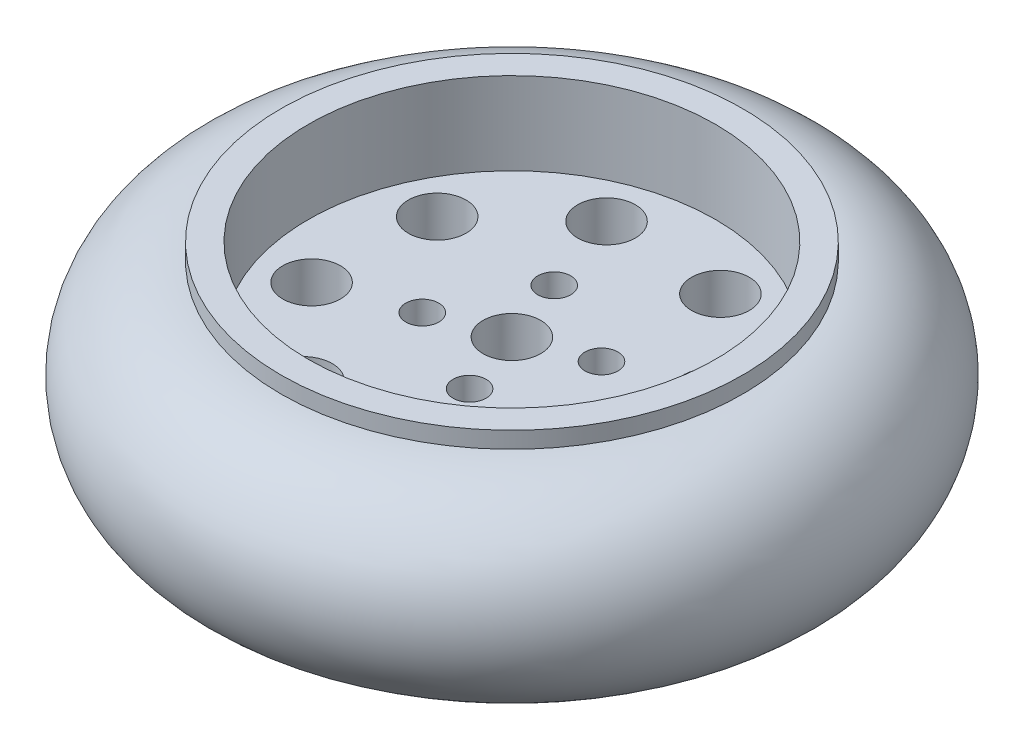
from build123d import *

# Parameters (mm, degrees)
ESQUISSE1_R             = 40
BOSS_EXTRU_1_DEPTH      = 24
CONG_2_R                = 12
ESQUISSE2_R             = 28
ENL_V_MAT_EXTRU_1_DEPTH = 8
ENL_V_START             = -8
ESQUISSE3_R             = 28
ENL_V_MAT_EXTRU_2_DEPTH = 8
ESQUISSE4_R             = 3.5
ESQUISSE4_R_2           = 2
ENL_V_MAT_EXTRU_3_DEPTH = 59.787753895
BOSS_EXTRU_2_START      = 10
ESQUISSE5_R             = 28
ESQUISSE5_R_2           = 24.698706658
BOSS_EXTRU_2_DEPTH      = 10


with BuildPart() as part:
    # Esquisse1 → Boss.-Extru.1 (new body)
    with BuildSketch(Plane(origin=(0, 0, 0), x_dir=(1, 0, 0), z_dir=(0, 1, 0))):
        with Locations(Location((0, 0, 0), (0, 0, 270))):
            Circle(ESQUISSE1_R)
    extrude(amount=BOSS_EXTRU_1_DEPTH)

    # Congé2
    cong_2_edges = [part.edges().sort_by_distance(p)[0] for p in [
        (0, 0, -40),
        (0, 24, -40),
    ]]
    fillet(cong_2_edges, radius=CONG_2_R - 0.0001)  # a hair under: the kernel refuses the full size

    # Esquisse2 → Enlèv. mat.-Extru.1 (cut)
    with BuildSketch(Plane(origin=(0, 24, 0), x_dir=(1, 0, 0), z_dir=(0, 1, 0))):
        with Locations(Location((0, 0, 0), (0, 0, 270))):
            Circle(ESQUISSE2_R)
    extrude(amount=-ENL_V_MAT_EXTRU_1_DEPTH, mode=Mode.SUBTRACT)

    # Esquisse3 → Enlèv. mat.-Extru.2 (cut)
    with BuildSketch(Plane.XZ.offset(ENL_V_START)):
        with Locations(Location((0, 0, 0), (0, 0, 90))):
            Circle(ESQUISSE3_R)
    extrude(amount=ENL_V_MAT_EXTRU_2_DEPTH, mode=Mode.SUBTRACT)

    # Esquisse4 → Enlèv. mat.-Extru.3 (cut, through all)
    with BuildSketch(Plane(origin=(0, 16, 0), x_dir=(1, 0, 0), z_dir=(0, 1, 0))):
        with Locations(Location((0, 0, 0), (0, 0, 270))):
            Circle(ESQUISSE4_R)
        with Locations(Location((-2.866979911, 8.001901411, 0), (0, 0, 270))):
            Circle(ESQUISSE4_R_2)
        with Locations(Location((8.001901411, 2.866979911, 0), (0, 0, 270))):
            Circle(ESQUISSE4_R_2)
        with Locations(Location((2.866979911, -8.001901411, 0), (0, 0, 270))):
            Circle(ESQUISSE4_R_2)
        with Locations(Location((-8.001901411, -2.866979911, 0), (0, 0, 270))):
            Circle(ESQUISSE4_R_2)
        with Locations(Location((-6.408543331, 17.886603154, 0), (0, 0, 270))):
            Circle(ESQUISSE4_R)
        with Locations(Location((8.116213936, 17.179262829, 0), (0, 0, 270))):
            Circle(ESQUISSE4_R)
        with Locations(Location((17.886603154, 6.408543331, 0), (0, 0, 270))):
            Circle(ESQUISSE4_R)
        with Locations(Location((17.179262829, -8.116213936, 0), (0, 0, 270))):
            Circle(ESQUISSE4_R)
        with Locations(Location((6.408543331, -17.886603154, 0), (0, 0, 270))):
            Circle(ESQUISSE4_R)
        with Locations(Location((-8.116213936, -17.179262829, 0), (0, 0, 270))):
            Circle(ESQUISSE4_R)
        with Locations(Location((-17.886603154, -6.408543331, 0), (0, 0, 270))):
            Circle(ESQUISSE4_R)
        with Locations(Location((-17.179262829, 8.116213936, 0), (0, 0, 270))):
            Circle(ESQUISSE4_R)
    extrude(amount=-ENL_V_MAT_EXTRU_3_DEPTH, mode=Mode.SUBTRACT)

    # Esquisse5 → Boss.-Extru.2 (add)
    with BuildSketch(Plane(origin=(0, 16, 0), x_dir=(1, 0, 0), z_dir=(0, 1, 0)).offset(BOSS_EXTRU_2_START)):
        with Locations(Location((0, 0, 0), (0, 0, 90))):
            Circle(ESQUISSE5_R)
        with Locations(Location((0, 0, 0), (0, 0, 270))):
            Circle(ESQUISSE5_R_2, mode=Mode.SUBTRACT)
    extrude(amount=-BOSS_EXTRU_2_DEPTH)


solid = part.part
